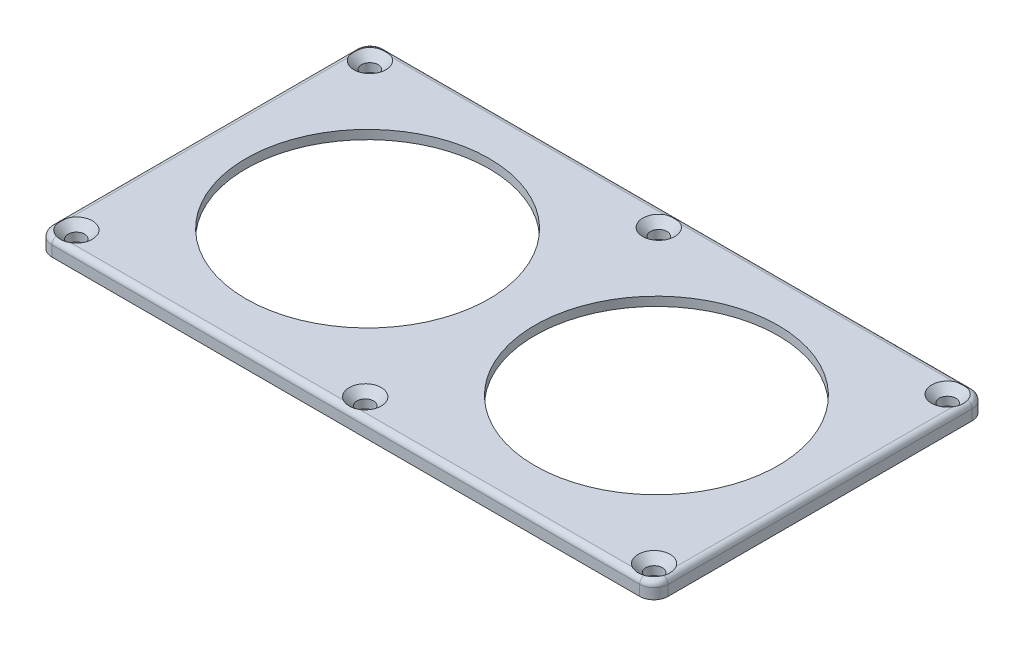
from build123d import *

# Parameters (mm, degrees)
SKETCH1_R           = 2.05
BOSS_EXTRUDE1_DEPTH = 4
FILLET1_R           = 1.4
CHAMFER1_SIZE       = 1.9
CUT_EXTRUDE1_DEPTH  = 1.8
SKETCH4_R           = 30
CUT_EXTRUDE2_DEPTH  = 87.446515392


with BuildPart() as part:
    # Sketch1 → Boss-Extrude1 (new body)
    with BuildSketch(Plane(origin=(0, 0, 0), x_dir=(1, 0, 0), z_dir=(0, 1, 0))):
        with BuildLine():
            Line((72.5, -41), (-72.5, -41))
            ThreePointArc((-72.5, -41), (-74.974873734, -39.974873734), (-76, -37.5))
            Line((-76, -37.5), (-76, 37.5))
            ThreePointArc((-76, 37.5), (-74.974873734, 39.974873734), (-72.5, 41))
            Line((-72.5, 41), (72.5, 41))
            ThreePointArc((72.5, 41), (74.974873734, 39.974873734), (76, 37.5))
            Line((76, 37.5), (76, -37.5))
            ThreePointArc((76, -37.5), (74.974873734, -39.974873734), (72.5, -41))
        make_face()
        with Locations(Location((-71.25, 36.2, 0), (0, 0, 270))):
            Circle(SKETCH1_R, mode=Mode.SUBTRACT)
        with Locations(Location((-71.25, -36.2, 0), (0, 0, 270))):
            Circle(SKETCH1_R, mode=Mode.SUBTRACT)
        with Locations(Location((71.25, -36.2, 0), (0, 0, 270))):
            Circle(SKETCH1_R, mode=Mode.SUBTRACT)
        with Locations(Location((71.25, 36.2, 0), (0, 0, 270))):
            Circle(SKETCH1_R, mode=Mode.SUBTRACT)
        with Locations(Location((0, 36.2, 0), (0, 0, 270))):
            Circle(SKETCH1_R, mode=Mode.SUBTRACT)
        with Locations(Location((0, -36.2, 0), (0, 0, 270))):
            Circle(SKETCH1_R, mode=Mode.SUBTRACT)
    extrude(amount=BOSS_EXTRUDE1_DEPTH)

    # Fillet1
    fillet1_edges = [part.edges().sort_by_distance(p)[0] for p in [
        (74.974873734, 4, 39.974873734),
        (76, 4, 0),
        (74.974873734, 4, -39.974873734),
        (0, 4, -41),
        (-74.974873734, 4, -39.974873734),
        (-76, 4, 0),
        (-74.974873734, 4, 39.974873734),
        (0, 4, 41),
    ]]
    fillet(fillet1_edges, radius=FILLET1_R)

    # Chamfer1
    # the kernel refuses this chamfer: 1.9 mm, written as the material it takes off along each edge
    with BuildSketch(Plane(origin=(71.25, 4, 36.2), x_dir=(0, 0, 1), z_dir=(-1, 0, 0))) as chamfer1_piece_1:
        Polygon((2.05 + CHAMFER1_SIZE, 0), (2.05, -CHAMFER1_SIZE), (2.05, 0), align=None)
    revolve(axis=Axis((71.25, 4, 36.2), (0, 1, 0)), mode=Mode.SUBTRACT)
    with BuildSketch(Plane(origin=(71.25, 4, -36.2), x_dir=(0, 0, 1), z_dir=(-1, 0, 0))) as chamfer1_piece_2:
        Polygon((2.05 + CHAMFER1_SIZE, 0), (2.05, -CHAMFER1_SIZE), (2.05, 0), align=None)
    revolve(axis=Axis((71.25, 4, -36.2), (0, 1, 0)), mode=Mode.SUBTRACT)
    with BuildSketch(Plane(origin=(-71.25, 4, 36.2), x_dir=(0, 0, 1), z_dir=(-1, 0, 0))) as chamfer1_piece_3:
        Polygon((2.05 + CHAMFER1_SIZE, 0), (2.05, -CHAMFER1_SIZE), (2.05, 0), align=None)
    revolve(axis=Axis((-71.25, 4, 36.2), (0, 1, 0)), mode=Mode.SUBTRACT)
    with BuildSketch(Plane(origin=(-71.25, 4, -36.2), x_dir=(0, 0, 1), z_dir=(-1, 0, 0))) as chamfer1_piece_4:
        Polygon((2.05 + CHAMFER1_SIZE, 0), (2.05, -CHAMFER1_SIZE), (2.05, 0), align=None)
    revolve(axis=Axis((-71.25, 4, -36.2), (0, 1, 0)), mode=Mode.SUBTRACT)
    with BuildSketch(Plane(origin=(0, 4, 36.2), x_dir=(0, 0, 1), z_dir=(-1, 0, 0))) as chamfer1_piece_5:
        Polygon((2.05 + CHAMFER1_SIZE, 0), (2.05, -CHAMFER1_SIZE), (2.05, 0), align=None)
    revolve(axis=Axis((0, 4, 36.2), (0, 1, 0)), mode=Mode.SUBTRACT)
    with BuildSketch(Plane(origin=(0, 4, -36.2), x_dir=(0, 0, 1), z_dir=(-1, 0, 0))) as chamfer1_piece_6:
        Polygon((2.05 + CHAMFER1_SIZE, 0), (2.05, -CHAMFER1_SIZE), (2.05, 0), align=None)
    revolve(axis=Axis((0, 4, -36.2), (0, 1, 0)), mode=Mode.SUBTRACT)

    # Sketch2 → Cut-Extrude1 (cut)
    with BuildSketch(Plane.XZ):
        with BuildLine():
            Line((-71.25, 33.35), (-72.5, 33.35))
            Line((-72.5, 33.35), (-72.5, -33.35))
            Line((-72.5, -33.35), (-71.25, -33.35))
            ThreePointArc((-71.25, -33.35), (-69.234745674, -34.184745674), (-68.4, -36.2))
            Line((-68.4, -36.2), (-68.4, -37.45))
            Line((-68.4, -37.45), (-2.85, -37.45))
            Line((-2.85, -37.45), (-2.85, -36.2))
            ThreePointArc((-2.85, -36.2), (0, -33.35), (2.85, -36.2))
            Line((2.85, -36.2), (2.85, -37.45))
            Line((2.85, -37.45), (68.4, -37.45))
            Line((68.4, -37.45), (68.4, -36.2))
            ThreePointArc((68.4, -36.2), (69.234745674, -34.184745674), (71.25, -33.35))
            Line((71.25, -33.35), (72.5, -33.35))
            Line((72.5, -33.35), (72.5, 33.35))
            Line((72.5, 33.35), (71.25, 33.35))
            ThreePointArc((71.25, 33.35), (69.234745674, 34.184745674), (68.4, 36.2))
            Line((68.4, 36.2), (68.4, 37.45))
            Line((68.4, 37.45), (2.85, 37.45))
            Line((2.85, 37.45), (2.85, 36.2))
            ThreePointArc((2.85, 36.2), (0, 33.35), (-2.85, 36.2))
            Line((-2.85, 36.2), (-2.85, 37.45))
            Line((-2.85, 37.45), (-68.4, 37.45))
            Line((-68.4, 37.45), (-68.4, 36.2))
            ThreePointArc((-68.4, 36.2), (-69.234745674, 34.184745674), (-71.25, 33.35))
        make_face()
    extrude(amount=-CUT_EXTRUDE1_DEPTH, mode=Mode.SUBTRACT)

    # Sketch4 → Cut-Extrude2 (cut, through all)
    with BuildSketch(Plane(origin=(0, 4, 0), x_dir=(1, 0, 0), z_dir=(0, 1, 0))):
        with Locations(Location((-35.625, 0, 0), (0, 0, 270))):
            Circle(SKETCH4_R)
        with Locations(Location((35.625, 0, 0), (0, 0, 270))):
            Circle(SKETCH4_R)
    extrude(amount=-CUT_EXTRUDE2_DEPTH, mode=Mode.SUBTRACT)


solid = part.part
